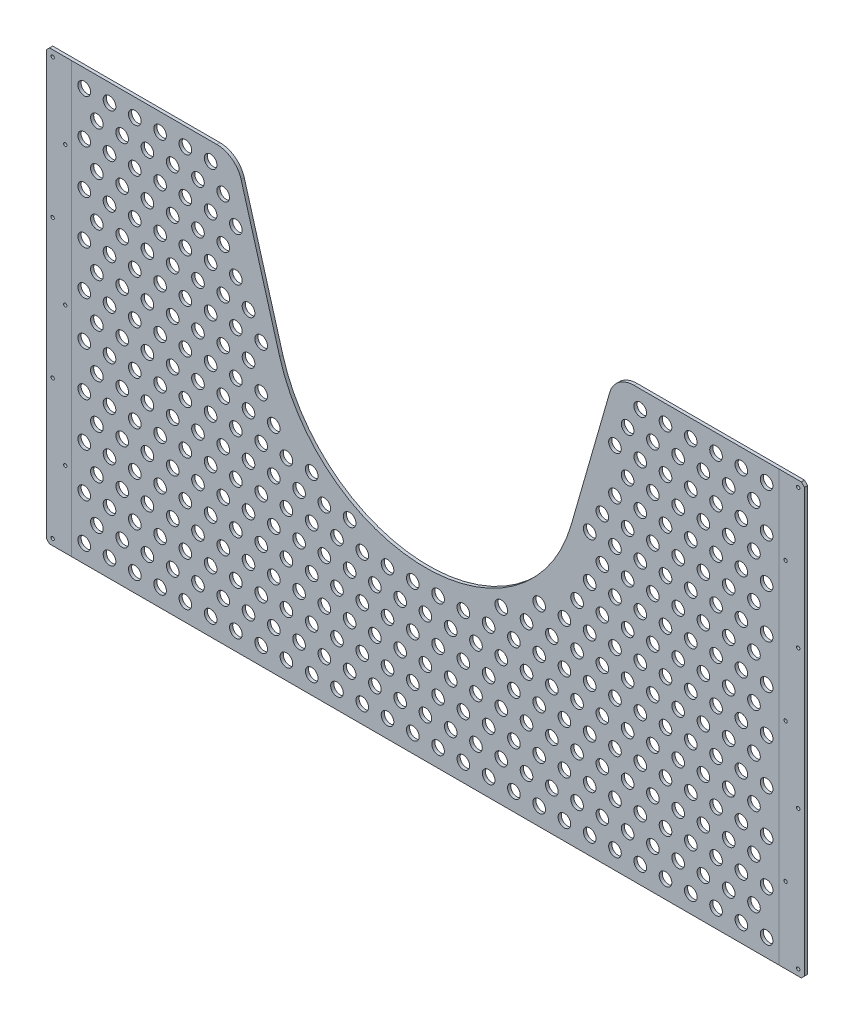
from build123d import *

# Parameters (mm, degrees)
BOSS_EXTRUDE1_DEPTH     = 3.175
SKETCH2_R               = 1.651
CUT_EXTRUDE1_DEPTH      = 876.845489013
CHAMFER1_SIZE           = 3.175
FILL_PATTERN1_OUTLINE_R = 6.35
FILL_PATTERN1_DEPTH     = 3.175


# Read off the part's stored shape, not the designer's step: Fill Pattern1
with BuildPart() as part:
    # Sketch1 → Boss-Extrude1 (new body)
    with BuildSketch(Plane.XY):
        with BuildLine():
            Line((195.783070924, 413.414999114), (234.527503102, 278.585005317))
            ThreePointArc((234.527503102, 278.585005317), (381, 168.275), (527.472496898, 278.585005317))
            Line((527.472496898, 278.585005317), (566.216929076, 413.414999114))
            ThreePointArc((566.216929076, 413.414999114), (575.348648308, 426.689664579), (590.629011892, 431.8))
            Line((590.629011892, 431.8), (762, 431.8))
            Line((762, 431.8), (762, 0))
            Line((762, 0), (0, 0))
            Line((0, 0), (0, 431.8))
            Line((0, 431.8), (171.370988108, 431.8))
            ThreePointArc((171.370988108, 431.8), (186.651351692, 426.689664579), (195.783070924, 413.414999114))
        make_face()
    extrude(amount=BOSS_EXTRUDE1_DEPTH)

    # Sketch2 → Cut-Extrude1 (cut, through all)
    with BuildSketch(Plane.XY.offset(3.175)):
        with Locations((6.35, 6.35)):
            Circle(SKETCH2_R)
        with Locations((19.05, 76.2)):
            Circle(SKETCH2_R)
        with Locations((6.35, 146.05)):
            Circle(SKETCH2_R)
        with Locations((19.05, 215.9)):
            Circle(SKETCH2_R)
        with Locations((6.35, 285.75)):
            Circle(SKETCH2_R)
        with Locations((19.05, 355.6)):
            Circle(SKETCH2_R)
        with Locations((6.35, 425.45)):
            Circle(SKETCH2_R)
        with Locations(Location((755.65, 425.45, 0), (0, 0, 180))):
            Circle(SKETCH2_R)
        with Locations(Location((742.95, 355.6, 0), (0, 0, 180))):
            Circle(SKETCH2_R)
        with Locations(Location((755.65, 285.75, 0), (0, 0, 180))):
            Circle(SKETCH2_R)
        with Locations(Location((742.95, 215.9, 0), (0, 0, 180))):
            Circle(SKETCH2_R)
        with Locations(Location((755.65, 146.05, 0), (0, 0, 180))):
            Circle(SKETCH2_R)
        with Locations(Location((742.95, 76.2, 0), (0, 0, 180))):
            Circle(SKETCH2_R)
        with Locations(Location((755.65, 6.35, 0), (0, 0, 180))):
            Circle(SKETCH2_R)
    extrude(amount=-CUT_EXTRUDE1_DEPTH, mode=Mode.SUBTRACT)

    # Chamfer1
    chamfer1_edges = [part.edges().sort_by_distance(p)[0] for p in [
        (0, 431.8, 1.5875),
        (762, 431.8, 1.5875),
        (762, 0, 1.5875),
        (0, 0, 1.5875),
    ]]
    chamfer(chamfer1_edges, length=CHAMFER1_SIZE)

    # Fill Pattern1 outline → Fill Pattern1 (cut)
    with BuildSketch(Plane.XY):
        with Locations((38.1, 413.873407305)):
            Circle(FILL_PATTERN1_OUTLINE_R)
        with Locations((685.8, 215.9)):
            Circle(FILL_PATTERN1_OUTLINE_R)
        with Locations((711.2, 215.9)):
            Circle(FILL_PATTERN1_OUTLINE_R)
        with Locations((165.1, 413.873407305)):
            Circle(FILL_PATTERN1_OUTLINE_R)
        with Locations((165.1, 369.879316793)):
            Circle(FILL_PATTERN1_OUTLINE_R)
        with Locations((165.1, 325.885226281)):
            Circle(FILL_PATTERN1_OUTLINE_R)
        with Locations((165.1, 281.891135768)):
            Circle(FILL_PATTERN1_OUTLINE_R)
        with Locations((165.1, 237.897045256)):
            Circle(FILL_PATTERN1_OUTLINE_R)
        with Locations((190.5, 237.897045256)):
            Circle(FILL_PATTERN1_OUTLINE_R)
        with Locations((584.2, 391.876362049)):
            Circle(FILL_PATTERN1_OUTLINE_R)
        with Locations((546.1, 281.891135768)):
            Circle(FILL_PATTERN1_OUTLINE_R)
        with Locations((533.4, 215.9)):
            Circle(FILL_PATTERN1_OUTLINE_R)
        with Locations((558.8, 215.9)):
            Circle(FILL_PATTERN1_OUTLINE_R)
        with Locations((584.2, 215.9)):
            Circle(FILL_PATTERN1_OUTLINE_R)
        with Locations((609.6, 215.9)):
            Circle(FILL_PATTERN1_OUTLINE_R)
        with Locations((635, 215.9)):
            Circle(FILL_PATTERN1_OUTLINE_R)
        with Locations((660.4, 215.9)):
            Circle(FILL_PATTERN1_OUTLINE_R)
        with Locations((177.8, 391.876362049)):
            Circle(FILL_PATTERN1_OUTLINE_R)
        with Locations((723.9, 237.897045256)):
            Circle(FILL_PATTERN1_OUTLINE_R)
        with Locations((698.5, 237.897045256)):
            Circle(FILL_PATTERN1_OUTLINE_R)
        with Locations((673.1, 237.897045256)):
            Circle(FILL_PATTERN1_OUTLINE_R)
        with Locations((177.8, 347.882271537)):
            Circle(FILL_PATTERN1_OUTLINE_R)
        with Locations((177.8, 303.888181024)):
            Circle(FILL_PATTERN1_OUTLINE_R)
        with Locations((177.8, 259.894090512)):
            Circle(FILL_PATTERN1_OUTLINE_R)
        with Locations((203.2, 259.894090512)):
            Circle(FILL_PATTERN1_OUTLINE_R)
        with Locations((546.1, 237.897045256)):
            Circle(FILL_PATTERN1_OUTLINE_R)
        with Locations((558.8, 303.888181024)):
            Circle(FILL_PATTERN1_OUTLINE_R)
        with Locations((596.9, 413.873407305)):
            Circle(FILL_PATTERN1_OUTLINE_R)
        with Locations((215.9, 237.897045256)):
            Circle(FILL_PATTERN1_OUTLINE_R)
        with Locations((571.5, 237.897045256)):
            Circle(FILL_PATTERN1_OUTLINE_R)
        with Locations((596.9, 237.897045256)):
            Circle(FILL_PATTERN1_OUTLINE_R)
        with Locations((622.3, 237.897045256)):
            Circle(FILL_PATTERN1_OUTLINE_R)
        with Locations((647.7, 237.897045256)):
            Circle(FILL_PATTERN1_OUTLINE_R)
        with Locations((266.7, 193.902954744)):
            Circle(FILL_PATTERN1_OUTLINE_R)
        with Locations((571.5, 369.879316793)):
            Circle(FILL_PATTERN1_OUTLINE_R)
        with Locations((495.3, 193.902954744)):
            Circle(FILL_PATTERN1_OUTLINE_R)
        with Locations((520.7, 193.902954744)):
            Circle(FILL_PATTERN1_OUTLINE_R)
        with Locations((241.3, 193.902954744)):
            Circle(FILL_PATTERN1_OUTLINE_R)
        with Locations((215.9, 193.902954744)):
            Circle(FILL_PATTERN1_OUTLINE_R)
        with Locations((190.5, 193.902954744)):
            Circle(FILL_PATTERN1_OUTLINE_R)
        with Locations((165.1, 193.902954744)):
            Circle(FILL_PATTERN1_OUTLINE_R)
        with Locations((685.8, 171.905909488)):
            Circle(FILL_PATTERN1_OUTLINE_R)
        with Locations((711.2, 171.905909488)):
            Circle(FILL_PATTERN1_OUTLINE_R)
        with Locations((139.7, 413.873407305)):
            Circle(FILL_PATTERN1_OUTLINE_R)
        with Locations((139.7, 369.879316793)):
            Circle(FILL_PATTERN1_OUTLINE_R)
        with Locations((139.7, 325.885226281)):
            Circle(FILL_PATTERN1_OUTLINE_R)
        with Locations((139.7, 281.891135768)):
            Circle(FILL_PATTERN1_OUTLINE_R)
        with Locations((139.7, 237.897045256)):
            Circle(FILL_PATTERN1_OUTLINE_R)
        with Locations((139.7, 193.902954744)):
            Circle(FILL_PATTERN1_OUTLINE_R)
        with Locations((546.1, 193.902954744)):
            Circle(FILL_PATTERN1_OUTLINE_R)
        with Locations((571.5, 193.902954744)):
            Circle(FILL_PATTERN1_OUTLINE_R)
        with Locations((596.9, 193.902954744)):
            Circle(FILL_PATTERN1_OUTLINE_R)
        with Locations((622.3, 193.902954744)):
            Circle(FILL_PATTERN1_OUTLINE_R)
        with Locations((647.7, 193.902954744)):
            Circle(FILL_PATTERN1_OUTLINE_R)
        with Locations((673.1, 193.902954744)):
            Circle(FILL_PATTERN1_OUTLINE_R)
        with Locations((698.5, 193.902954744)):
            Circle(FILL_PATTERN1_OUTLINE_R)
        with Locations((723.9, 193.902954744)):
            Circle(FILL_PATTERN1_OUTLINE_R)
        with Locations((152.4, 391.876362049)):
            Circle(FILL_PATTERN1_OUTLINE_R)
        with Locations((152.4, 347.882271537)):
            Circle(FILL_PATTERN1_OUTLINE_R)
        with Locations((152.4, 303.888181024)):
            Circle(FILL_PATTERN1_OUTLINE_R)
        with Locations((152.4, 259.894090512)):
            Circle(FILL_PATTERN1_OUTLINE_R)
        with Locations((152.4, 215.9)):
            Circle(FILL_PATTERN1_OUTLINE_R)
        with Locations((177.8, 215.9)):
            Circle(FILL_PATTERN1_OUTLINE_R)
        with Locations((203.2, 215.9)):
            Circle(FILL_PATTERN1_OUTLINE_R)
        with Locations((228.6, 215.9)):
            Circle(FILL_PATTERN1_OUTLINE_R)
        with Locations((673.1, 369.879316793)):
            Circle(FILL_PATTERN1_OUTLINE_R)
        with Locations((647.7, 369.879316793)):
            Circle(FILL_PATTERN1_OUTLINE_R)
        with Locations((622.3, 369.879316793)):
            Circle(FILL_PATTERN1_OUTLINE_R)
        with Locations((711.2, 347.882271537)):
            Circle(FILL_PATTERN1_OUTLINE_R)
        with Locations((698.5, 369.879316793)):
            Circle(FILL_PATTERN1_OUTLINE_R)
        with Locations((723.9, 369.879316793)):
            Circle(FILL_PATTERN1_OUTLINE_R)
        with Locations((635, 391.876362049)):
            Circle(FILL_PATTERN1_OUTLINE_R)
        with Locations((660.4, 391.876362049)):
            Circle(FILL_PATTERN1_OUTLINE_R)
        with Locations((622.3, 413.873407305)):
            Circle(FILL_PATTERN1_OUTLINE_R)
        with Locations((723.9, 325.885226281)):
            Circle(FILL_PATTERN1_OUTLINE_R)
        with Locations((698.5, 325.885226281)):
            Circle(FILL_PATTERN1_OUTLINE_R)
        with Locations((673.1, 325.885226281)):
            Circle(FILL_PATTERN1_OUTLINE_R)
        with Locations((609.6, 347.882271537)):
            Circle(FILL_PATTERN1_OUTLINE_R)
        with Locations((635, 347.882271537)):
            Circle(FILL_PATTERN1_OUTLINE_R)
        with Locations((660.4, 347.882271537)):
            Circle(FILL_PATTERN1_OUTLINE_R)
        with Locations((685.8, 347.882271537)):
            Circle(FILL_PATTERN1_OUTLINE_R)
        with Locations((723.9, 413.873407305)):
            Circle(FILL_PATTERN1_OUTLINE_R)
        with Locations((698.5, 413.873407305)):
            Circle(FILL_PATTERN1_OUTLINE_R)
        with Locations((673.1, 413.873407305)):
            Circle(FILL_PATTERN1_OUTLINE_R)
        with Locations((647.7, 413.873407305)):
            Circle(FILL_PATTERN1_OUTLINE_R)
        with Locations((711.2, 391.876362049)):
            Circle(FILL_PATTERN1_OUTLINE_R)
        with Locations((685.8, 391.876362049)):
            Circle(FILL_PATTERN1_OUTLINE_R)
        with Locations((584.2, 347.882271537)):
            Circle(FILL_PATTERN1_OUTLINE_R)
        with Locations((571.5, 281.891135768)):
            Circle(FILL_PATTERN1_OUTLINE_R)
        with Locations((596.9, 281.891135768)):
            Circle(FILL_PATTERN1_OUTLINE_R)
        with Locations((622.3, 281.891135768)):
            Circle(FILL_PATTERN1_OUTLINE_R)
        with Locations((215.9, 281.891135768)):
            Circle(FILL_PATTERN1_OUTLINE_R)
        with Locations((190.5, 281.891135768)):
            Circle(FILL_PATTERN1_OUTLINE_R)
        with Locations((190.5, 325.885226281)):
            Circle(FILL_PATTERN1_OUTLINE_R)
        with Locations((190.5, 369.879316793)):
            Circle(FILL_PATTERN1_OUTLINE_R)
        with Locations((711.2, 259.894090512)):
            Circle(FILL_PATTERN1_OUTLINE_R)
        with Locations((685.8, 259.894090512)):
            Circle(FILL_PATTERN1_OUTLINE_R)
        with Locations((660.4, 259.894090512)):
            Circle(FILL_PATTERN1_OUTLINE_R)
        with Locations((635, 259.894090512)):
            Circle(FILL_PATTERN1_OUTLINE_R)
        with Locations((571.5, 325.885226281)):
            Circle(FILL_PATTERN1_OUTLINE_R)
        with Locations((558.8, 259.894090512)):
            Circle(FILL_PATTERN1_OUTLINE_R)
        with Locations((584.2, 259.894090512)):
            Circle(FILL_PATTERN1_OUTLINE_R)
        with Locations((609.6, 259.894090512)):
            Circle(FILL_PATTERN1_OUTLINE_R)
        with Locations((609.6, 391.876362049)):
            Circle(FILL_PATTERN1_OUTLINE_R)
        with Locations((596.9, 325.885226281)):
            Circle(FILL_PATTERN1_OUTLINE_R)
        with Locations((622.3, 325.885226281)):
            Circle(FILL_PATTERN1_OUTLINE_R)
        with Locations((647.7, 325.885226281)):
            Circle(FILL_PATTERN1_OUTLINE_R)
        with Locations((711.2, 303.888181024)):
            Circle(FILL_PATTERN1_OUTLINE_R)
        with Locations((685.8, 303.888181024)):
            Circle(FILL_PATTERN1_OUTLINE_R)
        with Locations((660.4, 303.888181024)):
            Circle(FILL_PATTERN1_OUTLINE_R)
        with Locations((635, 303.888181024)):
            Circle(FILL_PATTERN1_OUTLINE_R)
        with Locations((203.2, 303.888181024)):
            Circle(FILL_PATTERN1_OUTLINE_R)
        with Locations((596.9, 369.879316793)):
            Circle(FILL_PATTERN1_OUTLINE_R)
        with Locations((584.2, 303.888181024)):
            Circle(FILL_PATTERN1_OUTLINE_R)
        with Locations((609.6, 303.888181024)):
            Circle(FILL_PATTERN1_OUTLINE_R)
        with Locations((723.9, 281.891135768)):
            Circle(FILL_PATTERN1_OUTLINE_R)
        with Locations((698.5, 281.891135768)):
            Circle(FILL_PATTERN1_OUTLINE_R)
        with Locations((673.1, 281.891135768)):
            Circle(FILL_PATTERN1_OUTLINE_R)
        with Locations((647.7, 281.891135768)):
            Circle(FILL_PATTERN1_OUTLINE_R)
        with Locations((469.9, 61.920683207)):
            Circle(FILL_PATTERN1_OUTLINE_R)
        with Locations((444.5, 61.920683207)):
            Circle(FILL_PATTERN1_OUTLINE_R)
        with Locations((419.1, 61.920683207)):
            Circle(FILL_PATTERN1_OUTLINE_R)
        with Locations((393.7, 61.920683207)):
            Circle(FILL_PATTERN1_OUTLINE_R)
        with Locations((368.3, 61.920683207)):
            Circle(FILL_PATTERN1_OUTLINE_R)
        with Locations((342.9, 61.920683207)):
            Circle(FILL_PATTERN1_OUTLINE_R)
        with Locations((317.5, 61.920683207)):
            Circle(FILL_PATTERN1_OUTLINE_R)
        with Locations((292.1, 61.920683207)):
            Circle(FILL_PATTERN1_OUTLINE_R)
        with Locations((266.7, 61.920683207)):
            Circle(FILL_PATTERN1_OUTLINE_R)
        with Locations((241.3, 61.920683207)):
            Circle(FILL_PATTERN1_OUTLINE_R)
        with Locations((215.9, 61.920683207)):
            Circle(FILL_PATTERN1_OUTLINE_R)
        with Locations((190.5, 61.920683207)):
            Circle(FILL_PATTERN1_OUTLINE_R)
        with Locations((165.1, 61.920683207)):
            Circle(FILL_PATTERN1_OUTLINE_R)
        with Locations((139.7, 61.920683207)):
            Circle(FILL_PATTERN1_OUTLINE_R)
        with Locations((114.3, 61.920683207)):
            Circle(FILL_PATTERN1_OUTLINE_R)
        with Locations((88.9, 61.920683207)):
            Circle(FILL_PATTERN1_OUTLINE_R)
        with Locations((660.4, 39.923637951)):
            Circle(FILL_PATTERN1_OUTLINE_R)
        with Locations((685.8, 39.923637951)):
            Circle(FILL_PATTERN1_OUTLINE_R)
        with Locations((711.2, 39.923637951)):
            Circle(FILL_PATTERN1_OUTLINE_R)
        with Locations((63.5, 413.873407305)):
            Circle(FILL_PATTERN1_OUTLINE_R)
        with Locations((635, 39.923637951)):
            Circle(FILL_PATTERN1_OUTLINE_R)
        with Locations((609.6, 39.923637951)):
            Circle(FILL_PATTERN1_OUTLINE_R)
        with Locations((584.2, 39.923637951)):
            Circle(FILL_PATTERN1_OUTLINE_R)
        with Locations((558.8, 39.923637951)):
            Circle(FILL_PATTERN1_OUTLINE_R)
        with Locations((63.5, 369.879316793)):
            Circle(FILL_PATTERN1_OUTLINE_R)
        with Locations((63.5, 325.885226281)):
            Circle(FILL_PATTERN1_OUTLINE_R)
        with Locations((63.5, 281.891135768)):
            Circle(FILL_PATTERN1_OUTLINE_R)
        with Locations((63.5, 237.897045256)):
            Circle(FILL_PATTERN1_OUTLINE_R)
        with Locations((63.5, 193.902954744)):
            Circle(FILL_PATTERN1_OUTLINE_R)
        with Locations((63.5, 149.908864232)):
            Circle(FILL_PATTERN1_OUTLINE_R)
        with Locations((63.5, 105.914773719)):
            Circle(FILL_PATTERN1_OUTLINE_R)
        with Locations((63.5, 61.920683207)):
            Circle(FILL_PATTERN1_OUTLINE_R)
        with Locations((431.8, 83.917728463)):
            Circle(FILL_PATTERN1_OUTLINE_R)
        with Locations((406.4, 83.917728463)):
            Circle(FILL_PATTERN1_OUTLINE_R)
        with Locations((381, 83.917728463)):
            Circle(FILL_PATTERN1_OUTLINE_R)
        with Locations((355.6, 83.917728463)):
            Circle(FILL_PATTERN1_OUTLINE_R)
        with Locations((330.2, 83.917728463)):
            Circle(FILL_PATTERN1_OUTLINE_R)
        with Locations((304.8, 83.917728463)):
            Circle(FILL_PATTERN1_OUTLINE_R)
        with Locations((279.4, 83.917728463)):
            Circle(FILL_PATTERN1_OUTLINE_R)
        with Locations((254, 83.917728463)):
            Circle(FILL_PATTERN1_OUTLINE_R)
        with Locations((228.6, 83.917728463)):
            Circle(FILL_PATTERN1_OUTLINE_R)
        with Locations((203.2, 83.917728463)):
            Circle(FILL_PATTERN1_OUTLINE_R)
        with Locations((177.8, 83.917728463)):
            Circle(FILL_PATTERN1_OUTLINE_R)
        with Locations((152.4, 83.917728463)):
            Circle(FILL_PATTERN1_OUTLINE_R)
        with Locations((127, 83.917728463)):
            Circle(FILL_PATTERN1_OUTLINE_R)
        with Locations((101.6, 83.917728463)):
            Circle(FILL_PATTERN1_OUTLINE_R)
        with Locations((76.2, 83.917728463)):
            Circle(FILL_PATTERN1_OUTLINE_R)
        with Locations((76.2, 127.911818976)):
            Circle(FILL_PATTERN1_OUTLINE_R)
        with Locations((495.3, 61.920683207)):
            Circle(FILL_PATTERN1_OUTLINE_R)
        with Locations((520.7, 61.920683207)):
            Circle(FILL_PATTERN1_OUTLINE_R)
        with Locations((546.1, 61.920683207)):
            Circle(FILL_PATTERN1_OUTLINE_R)
        with Locations((571.5, 61.920683207)):
            Circle(FILL_PATTERN1_OUTLINE_R)
        with Locations((596.9, 61.920683207)):
            Circle(FILL_PATTERN1_OUTLINE_R)
        with Locations((622.3, 61.920683207)):
            Circle(FILL_PATTERN1_OUTLINE_R)
        with Locations((647.7, 61.920683207)):
            Circle(FILL_PATTERN1_OUTLINE_R)
        with Locations((673.1, 61.920683207)):
            Circle(FILL_PATTERN1_OUTLINE_R)
        with Locations((76.2, 171.905909488)):
            Circle(FILL_PATTERN1_OUTLINE_R)
        with Locations((76.2, 215.9)):
            Circle(FILL_PATTERN1_OUTLINE_R)
        with Locations((76.2, 259.894090512)):
            Circle(FILL_PATTERN1_OUTLINE_R)
        with Locations((76.2, 303.888181024)):
            Circle(FILL_PATTERN1_OUTLINE_R)
        with Locations((76.2, 347.882271537)):
            Circle(FILL_PATTERN1_OUTLINE_R)
        with Locations((76.2, 391.876362049)):
            Circle(FILL_PATTERN1_OUTLINE_R)
        with Locations((723.9, 61.920683207)):
            Circle(FILL_PATTERN1_OUTLINE_R)
        with Locations((698.5, 61.920683207)):
            Circle(FILL_PATTERN1_OUTLINE_R)
        with Locations((38.1, 369.879316793)):
            Circle(FILL_PATTERN1_OUTLINE_R)
        with Locations((38.1, 325.885226281)):
            Circle(FILL_PATTERN1_OUTLINE_R)
        with Locations((38.1, 281.891135768)):
            Circle(FILL_PATTERN1_OUTLINE_R)
        with Locations((38.1, 237.897045256)):
            Circle(FILL_PATTERN1_OUTLINE_R)
        with Locations((38.1, 193.902954744)):
            Circle(FILL_PATTERN1_OUTLINE_R)
        with Locations((38.1, 149.908864232)):
            Circle(FILL_PATTERN1_OUTLINE_R)
        with Locations((38.1, 105.914773719)):
            Circle(FILL_PATTERN1_OUTLINE_R)
        with Locations((38.1, 61.920683207)):
            Circle(FILL_PATTERN1_OUTLINE_R)
        with Locations((38.1, 17.926592695)):
            Circle(FILL_PATTERN1_OUTLINE_R)
        with Locations((63.5, 17.926592695)):
            Circle(FILL_PATTERN1_OUTLINE_R)
        with Locations((88.9, 17.926592695)):
            Circle(FILL_PATTERN1_OUTLINE_R)
        with Locations((114.3, 17.926592695)):
            Circle(FILL_PATTERN1_OUTLINE_R)
        with Locations((139.7, 17.926592695)):
            Circle(FILL_PATTERN1_OUTLINE_R)
        with Locations((165.1, 17.926592695)):
            Circle(FILL_PATTERN1_OUTLINE_R)
        with Locations((190.5, 17.926592695)):
            Circle(FILL_PATTERN1_OUTLINE_R)
        with Locations((215.9, 17.926592695)):
            Circle(FILL_PATTERN1_OUTLINE_R)
        with Locations((241.3, 17.926592695)):
            Circle(FILL_PATTERN1_OUTLINE_R)
        with Locations((266.7, 17.926592695)):
            Circle(FILL_PATTERN1_OUTLINE_R)
        with Locations((292.1, 17.926592695)):
            Circle(FILL_PATTERN1_OUTLINE_R)
        with Locations((317.5, 17.926592695)):
            Circle(FILL_PATTERN1_OUTLINE_R)
        with Locations((342.9, 17.926592695)):
            Circle(FILL_PATTERN1_OUTLINE_R)
        with Locations((368.3, 17.926592695)):
            Circle(FILL_PATTERN1_OUTLINE_R)
        with Locations((393.7, 17.926592695)):
            Circle(FILL_PATTERN1_OUTLINE_R)
        with Locations((419.1, 17.926592695)):
            Circle(FILL_PATTERN1_OUTLINE_R)
        with Locations((444.5, 17.926592695)):
            Circle(FILL_PATTERN1_OUTLINE_R)
        with Locations((469.9, 17.926592695)):
            Circle(FILL_PATTERN1_OUTLINE_R)
        with Locations((495.3, 17.926592695)):
            Circle(FILL_PATTERN1_OUTLINE_R)
        with Locations((520.7, 17.926592695)):
            Circle(FILL_PATTERN1_OUTLINE_R)
        with Locations((546.1, 17.926592695)):
            Circle(FILL_PATTERN1_OUTLINE_R)
        with Locations((571.5, 17.926592695)):
            Circle(FILL_PATTERN1_OUTLINE_R)
        with Locations((596.9, 17.926592695)):
            Circle(FILL_PATTERN1_OUTLINE_R)
        with Locations((622.3, 17.926592695)):
            Circle(FILL_PATTERN1_OUTLINE_R)
        with Locations((533.4, 39.923637951)):
            Circle(FILL_PATTERN1_OUTLINE_R)
        with Locations((508, 39.923637951)):
            Circle(FILL_PATTERN1_OUTLINE_R)
        with Locations((482.6, 39.923637951)):
            Circle(FILL_PATTERN1_OUTLINE_R)
        with Locations((457.2, 39.923637951)):
            Circle(FILL_PATTERN1_OUTLINE_R)
        with Locations((431.8, 39.923637951)):
            Circle(FILL_PATTERN1_OUTLINE_R)
        with Locations((406.4, 39.923637951)):
            Circle(FILL_PATTERN1_OUTLINE_R)
        with Locations((381, 39.923637951)):
            Circle(FILL_PATTERN1_OUTLINE_R)
        with Locations((355.6, 39.923637951)):
            Circle(FILL_PATTERN1_OUTLINE_R)
        with Locations((330.2, 39.923637951)):
            Circle(FILL_PATTERN1_OUTLINE_R)
        with Locations((304.8, 39.923637951)):
            Circle(FILL_PATTERN1_OUTLINE_R)
        with Locations((279.4, 39.923637951)):
            Circle(FILL_PATTERN1_OUTLINE_R)
        with Locations((254, 39.923637951)):
            Circle(FILL_PATTERN1_OUTLINE_R)
        with Locations((228.6, 39.923637951)):
            Circle(FILL_PATTERN1_OUTLINE_R)
        with Locations((203.2, 39.923637951)):
            Circle(FILL_PATTERN1_OUTLINE_R)
        with Locations((177.8, 39.923637951)):
            Circle(FILL_PATTERN1_OUTLINE_R)
        with Locations((152.4, 39.923637951)):
            Circle(FILL_PATTERN1_OUTLINE_R)
        with Locations((647.7, 17.926592695)):
            Circle(FILL_PATTERN1_OUTLINE_R)
        with Locations((673.1, 17.926592695)):
            Circle(FILL_PATTERN1_OUTLINE_R)
        with Locations((698.5, 17.926592695)):
            Circle(FILL_PATTERN1_OUTLINE_R)
        with Locations((723.9, 17.926592695)):
            Circle(FILL_PATTERN1_OUTLINE_R)
        with Locations((50.8, 391.876362049)):
            Circle(FILL_PATTERN1_OUTLINE_R)
        with Locations((50.8, 347.882271537)):
            Circle(FILL_PATTERN1_OUTLINE_R)
        with Locations((50.8, 303.888181024)):
            Circle(FILL_PATTERN1_OUTLINE_R)
        with Locations((50.8, 259.894090512)):
            Circle(FILL_PATTERN1_OUTLINE_R)
        with Locations((50.8, 215.9)):
            Circle(FILL_PATTERN1_OUTLINE_R)
        with Locations((50.8, 171.905909488)):
            Circle(FILL_PATTERN1_OUTLINE_R)
        with Locations((50.8, 127.911818976)):
            Circle(FILL_PATTERN1_OUTLINE_R)
        with Locations((50.8, 83.917728463)):
            Circle(FILL_PATTERN1_OUTLINE_R)
        with Locations((50.8, 39.923637951)):
            Circle(FILL_PATTERN1_OUTLINE_R)
        with Locations((76.2, 39.923637951)):
            Circle(FILL_PATTERN1_OUTLINE_R)
        with Locations((101.6, 39.923637951)):
            Circle(FILL_PATTERN1_OUTLINE_R)
        with Locations((127, 39.923637951)):
            Circle(FILL_PATTERN1_OUTLINE_R)
        with Locations((469.9, 149.908864232)):
            Circle(FILL_PATTERN1_OUTLINE_R)
        with Locations((444.5, 149.908864232)):
            Circle(FILL_PATTERN1_OUTLINE_R)
        with Locations((419.1, 149.908864232)):
            Circle(FILL_PATTERN1_OUTLINE_R)
        with Locations((393.7, 149.908864232)):
            Circle(FILL_PATTERN1_OUTLINE_R)
        with Locations((368.3, 149.908864232)):
            Circle(FILL_PATTERN1_OUTLINE_R)
        with Locations((342.9, 149.908864232)):
            Circle(FILL_PATTERN1_OUTLINE_R)
        with Locations((317.5, 149.908864232)):
            Circle(FILL_PATTERN1_OUTLINE_R)
        with Locations((292.1, 149.908864232)):
            Circle(FILL_PATTERN1_OUTLINE_R)
        with Locations((266.7, 149.908864232)):
            Circle(FILL_PATTERN1_OUTLINE_R)
        with Locations((241.3, 149.908864232)):
            Circle(FILL_PATTERN1_OUTLINE_R)
        with Locations((215.9, 149.908864232)):
            Circle(FILL_PATTERN1_OUTLINE_R)
        with Locations((190.5, 149.908864232)):
            Circle(FILL_PATTERN1_OUTLINE_R)
        with Locations((165.1, 149.908864232)):
            Circle(FILL_PATTERN1_OUTLINE_R)
        with Locations((139.7, 149.908864232)):
            Circle(FILL_PATTERN1_OUTLINE_R)
        with Locations((114.3, 149.908864232)):
            Circle(FILL_PATTERN1_OUTLINE_R)
        with Locations((114.3, 193.902954744)):
            Circle(FILL_PATTERN1_OUTLINE_R)
        with Locations((457.2, 127.911818976)):
            Circle(FILL_PATTERN1_OUTLINE_R)
        with Locations((482.6, 127.911818976)):
            Circle(FILL_PATTERN1_OUTLINE_R)
        with Locations((508, 127.911818976)):
            Circle(FILL_PATTERN1_OUTLINE_R)
        with Locations((533.4, 127.911818976)):
            Circle(FILL_PATTERN1_OUTLINE_R)
        with Locations((558.8, 127.911818976)):
            Circle(FILL_PATTERN1_OUTLINE_R)
        with Locations((584.2, 127.911818976)):
            Circle(FILL_PATTERN1_OUTLINE_R)
        with Locations((609.6, 127.911818976)):
            Circle(FILL_PATTERN1_OUTLINE_R)
        with Locations((635, 127.911818976)):
            Circle(FILL_PATTERN1_OUTLINE_R)
        with Locations((114.3, 237.897045256)):
            Circle(FILL_PATTERN1_OUTLINE_R)
        with Locations((114.3, 281.891135768)):
            Circle(FILL_PATTERN1_OUTLINE_R)
        with Locations((114.3, 325.885226281)):
            Circle(FILL_PATTERN1_OUTLINE_R)
        with Locations((114.3, 369.879316793)):
            Circle(FILL_PATTERN1_OUTLINE_R)
        with Locations((660.4, 127.911818976)):
            Circle(FILL_PATTERN1_OUTLINE_R)
        with Locations((685.8, 127.911818976)):
            Circle(FILL_PATTERN1_OUTLINE_R)
        with Locations((711.2, 127.911818976)):
            Circle(FILL_PATTERN1_OUTLINE_R)
        with Locations((114.3, 413.873407305)):
            Circle(FILL_PATTERN1_OUTLINE_R)
        with Locations((660.4, 171.905909488)):
            Circle(FILL_PATTERN1_OUTLINE_R)
        with Locations((635, 171.905909488)):
            Circle(FILL_PATTERN1_OUTLINE_R)
        with Locations((609.6, 171.905909488)):
            Circle(FILL_PATTERN1_OUTLINE_R)
        with Locations((584.2, 171.905909488)):
            Circle(FILL_PATTERN1_OUTLINE_R)
        with Locations((558.8, 171.905909488)):
            Circle(FILL_PATTERN1_OUTLINE_R)
        with Locations((533.4, 171.905909488)):
            Circle(FILL_PATTERN1_OUTLINE_R)
        with Locations((508, 171.905909488)):
            Circle(FILL_PATTERN1_OUTLINE_R)
        with Locations((482.6, 171.905909488)):
            Circle(FILL_PATTERN1_OUTLINE_R)
        with Locations((457.2, 171.905909488)):
            Circle(FILL_PATTERN1_OUTLINE_R)
        with Locations((304.8, 171.905909488)):
            Circle(FILL_PATTERN1_OUTLINE_R)
        with Locations((279.4, 171.905909488)):
            Circle(FILL_PATTERN1_OUTLINE_R)
        with Locations((254, 171.905909488)):
            Circle(FILL_PATTERN1_OUTLINE_R)
        with Locations((228.6, 171.905909488)):
            Circle(FILL_PATTERN1_OUTLINE_R)
        with Locations((203.2, 171.905909488)):
            Circle(FILL_PATTERN1_OUTLINE_R)
        with Locations((177.8, 171.905909488)):
            Circle(FILL_PATTERN1_OUTLINE_R)
        with Locations((152.4, 171.905909488)):
            Circle(FILL_PATTERN1_OUTLINE_R)
        with Locations((495.3, 149.908864232)):
            Circle(FILL_PATTERN1_OUTLINE_R)
        with Locations((520.7, 149.908864232)):
            Circle(FILL_PATTERN1_OUTLINE_R)
        with Locations((546.1, 149.908864232)):
            Circle(FILL_PATTERN1_OUTLINE_R)
        with Locations((571.5, 149.908864232)):
            Circle(FILL_PATTERN1_OUTLINE_R)
        with Locations((596.9, 149.908864232)):
            Circle(FILL_PATTERN1_OUTLINE_R)
        with Locations((622.3, 149.908864232)):
            Circle(FILL_PATTERN1_OUTLINE_R)
        with Locations((647.7, 149.908864232)):
            Circle(FILL_PATTERN1_OUTLINE_R)
        with Locations((673.1, 149.908864232)):
            Circle(FILL_PATTERN1_OUTLINE_R)
        with Locations((127, 171.905909488)):
            Circle(FILL_PATTERN1_OUTLINE_R)
        with Locations((127, 215.9)):
            Circle(FILL_PATTERN1_OUTLINE_R)
        with Locations((127, 259.894090512)):
            Circle(FILL_PATTERN1_OUTLINE_R)
        with Locations((127, 303.888181024)):
            Circle(FILL_PATTERN1_OUTLINE_R)
        with Locations((127, 347.882271537)):
            Circle(FILL_PATTERN1_OUTLINE_R)
        with Locations((127, 391.876362049)):
            Circle(FILL_PATTERN1_OUTLINE_R)
        with Locations((723.9, 149.908864232)):
            Circle(FILL_PATTERN1_OUTLINE_R)
        with Locations((698.5, 149.908864232)):
            Circle(FILL_PATTERN1_OUTLINE_R)
        with Locations((419.1, 105.914773719)):
            Circle(FILL_PATTERN1_OUTLINE_R)
        with Locations((393.7, 105.914773719)):
            Circle(FILL_PATTERN1_OUTLINE_R)
        with Locations((368.3, 105.914773719)):
            Circle(FILL_PATTERN1_OUTLINE_R)
        with Locations((342.9, 105.914773719)):
            Circle(FILL_PATTERN1_OUTLINE_R)
        with Locations((317.5, 105.914773719)):
            Circle(FILL_PATTERN1_OUTLINE_R)
        with Locations((292.1, 105.914773719)):
            Circle(FILL_PATTERN1_OUTLINE_R)
        with Locations((266.7, 105.914773719)):
            Circle(FILL_PATTERN1_OUTLINE_R)
        with Locations((241.3, 105.914773719)):
            Circle(FILL_PATTERN1_OUTLINE_R)
        with Locations((215.9, 105.914773719)):
            Circle(FILL_PATTERN1_OUTLINE_R)
        with Locations((190.5, 105.914773719)):
            Circle(FILL_PATTERN1_OUTLINE_R)
        with Locations((165.1, 105.914773719)):
            Circle(FILL_PATTERN1_OUTLINE_R)
        with Locations((139.7, 105.914773719)):
            Circle(FILL_PATTERN1_OUTLINE_R)
        with Locations((114.3, 105.914773719)):
            Circle(FILL_PATTERN1_OUTLINE_R)
        with Locations((88.9, 105.914773719)):
            Circle(FILL_PATTERN1_OUTLINE_R)
        with Locations((88.9, 149.908864232)):
            Circle(FILL_PATTERN1_OUTLINE_R)
        with Locations((88.9, 193.902954744)):
            Circle(FILL_PATTERN1_OUTLINE_R)
        with Locations((457.2, 83.917728463)):
            Circle(FILL_PATTERN1_OUTLINE_R)
        with Locations((482.6, 83.917728463)):
            Circle(FILL_PATTERN1_OUTLINE_R)
        with Locations((508, 83.917728463)):
            Circle(FILL_PATTERN1_OUTLINE_R)
        with Locations((533.4, 83.917728463)):
            Circle(FILL_PATTERN1_OUTLINE_R)
        with Locations((558.8, 83.917728463)):
            Circle(FILL_PATTERN1_OUTLINE_R)
        with Locations((584.2, 83.917728463)):
            Circle(FILL_PATTERN1_OUTLINE_R)
        with Locations((609.6, 83.917728463)):
            Circle(FILL_PATTERN1_OUTLINE_R)
        with Locations((635, 83.917728463)):
            Circle(FILL_PATTERN1_OUTLINE_R)
        with Locations((88.9, 237.897045256)):
            Circle(FILL_PATTERN1_OUTLINE_R)
        with Locations((88.9, 281.891135768)):
            Circle(FILL_PATTERN1_OUTLINE_R)
        with Locations((88.9, 325.885226281)):
            Circle(FILL_PATTERN1_OUTLINE_R)
        with Locations((88.9, 369.879316793)):
            Circle(FILL_PATTERN1_OUTLINE_R)
        with Locations((660.4, 83.917728463)):
            Circle(FILL_PATTERN1_OUTLINE_R)
        with Locations((685.8, 83.917728463)):
            Circle(FILL_PATTERN1_OUTLINE_R)
        with Locations((711.2, 83.917728463)):
            Circle(FILL_PATTERN1_OUTLINE_R)
        with Locations((88.9, 413.873407305)):
            Circle(FILL_PATTERN1_OUTLINE_R)
        with Locations((431.8, 127.911818976)):
            Circle(FILL_PATTERN1_OUTLINE_R)
        with Locations((406.4, 127.911818976)):
            Circle(FILL_PATTERN1_OUTLINE_R)
        with Locations((381, 127.911818976)):
            Circle(FILL_PATTERN1_OUTLINE_R)
        with Locations((355.6, 127.911818976)):
            Circle(FILL_PATTERN1_OUTLINE_R)
        with Locations((330.2, 127.911818976)):
            Circle(FILL_PATTERN1_OUTLINE_R)
        with Locations((304.8, 127.911818976)):
            Circle(FILL_PATTERN1_OUTLINE_R)
        with Locations((279.4, 127.911818976)):
            Circle(FILL_PATTERN1_OUTLINE_R)
        with Locations((254, 127.911818976)):
            Circle(FILL_PATTERN1_OUTLINE_R)
        with Locations((228.6, 127.911818976)):
            Circle(FILL_PATTERN1_OUTLINE_R)
        with Locations((203.2, 127.911818976)):
            Circle(FILL_PATTERN1_OUTLINE_R)
        with Locations((177.8, 127.911818976)):
            Circle(FILL_PATTERN1_OUTLINE_R)
        with Locations((152.4, 127.911818976)):
            Circle(FILL_PATTERN1_OUTLINE_R)
        with Locations((127, 127.911818976)):
            Circle(FILL_PATTERN1_OUTLINE_R)
        with Locations((101.6, 127.911818976)):
            Circle(FILL_PATTERN1_OUTLINE_R)
        with Locations((101.6, 171.905909488)):
            Circle(FILL_PATTERN1_OUTLINE_R)
        with Locations((101.6, 215.9)):
            Circle(FILL_PATTERN1_OUTLINE_R)
        with Locations((444.5, 105.914773719)):
            Circle(FILL_PATTERN1_OUTLINE_R)
        with Locations((469.9, 105.914773719)):
            Circle(FILL_PATTERN1_OUTLINE_R)
        with Locations((495.3, 105.914773719)):
            Circle(FILL_PATTERN1_OUTLINE_R)
        with Locations((520.7, 105.914773719)):
            Circle(FILL_PATTERN1_OUTLINE_R)
        with Locations((546.1, 105.914773719)):
            Circle(FILL_PATTERN1_OUTLINE_R)
        with Locations((571.5, 105.914773719)):
            Circle(FILL_PATTERN1_OUTLINE_R)
        with Locations((596.9, 105.914773719)):
            Circle(FILL_PATTERN1_OUTLINE_R)
        with Locations((622.3, 105.914773719)):
            Circle(FILL_PATTERN1_OUTLINE_R)
        with Locations((647.7, 105.914773719)):
            Circle(FILL_PATTERN1_OUTLINE_R)
        with Locations((673.1, 105.914773719)):
            Circle(FILL_PATTERN1_OUTLINE_R)
        with Locations((698.5, 105.914773719)):
            Circle(FILL_PATTERN1_OUTLINE_R)
        with Locations((723.9, 105.914773719)):
            Circle(FILL_PATTERN1_OUTLINE_R)
        with Locations((101.6, 391.876362049)):
            Circle(FILL_PATTERN1_OUTLINE_R)
        with Locations((101.6, 347.882271537)):
            Circle(FILL_PATTERN1_OUTLINE_R)
        with Locations((101.6, 303.888181024)):
            Circle(FILL_PATTERN1_OUTLINE_R)
        with Locations((101.6, 259.894090512)):
            Circle(FILL_PATTERN1_OUTLINE_R)
    extrude(amount=FILL_PATTERN1_DEPTH, mode=Mode.SUBTRACT)


solid = part.part
